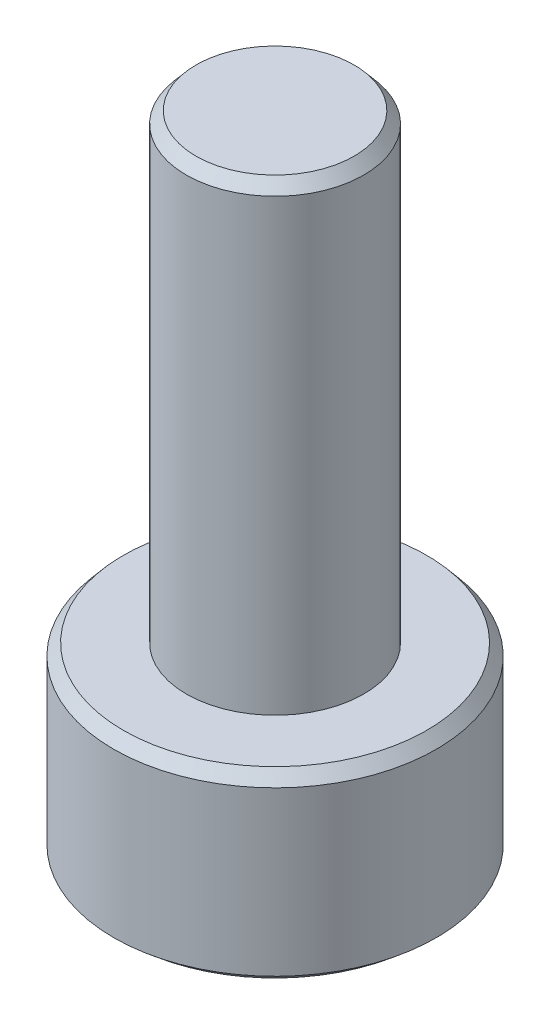
from build123d import *
from OCP.BRepFilletAPI import BRepFilletAPI_MakeChamfer

# Parameters (mm, degrees)
SKETCH1_R           = 3.5
BOSS_EXTRUDE1_DEPTH = 4
SKETCH2_R           = 1.925
BOSS_EXTRUDE2_DEPTH = 10
CUT_EXTRUDE1_DEPTH  = 2
CHAMFER1_SIZE       = 0.25
CHAMFER1_SIZE2      = 0.209774908


with BuildPart() as part:
    # Sketch1 → Boss-Extrude1 (new body)
    with BuildSketch(Plane(origin=(0, 0, 0), x_dir=(1, 0, 0), z_dir=(0, 1, 0))):
        Circle(SKETCH1_R)
    extrude(amount=BOSS_EXTRUDE1_DEPTH)

    # Sketch2 → Boss-Extrude2 (add)
    with BuildSketch(Plane(origin=(0, 4, 0), x_dir=(1, 0, 0), z_dir=(0, 1, 0))):
        Circle(SKETCH2_R)
    extrude(amount=BOSS_EXTRUDE2_DEPTH)

    # Sketch3 → Cut-Extrude1 (cut)
    with BuildSketch(Plane.XZ):
        Polygon((0, 2.37190351), (-2.054128695, 1.185951755), (-2.054128695, -1.185951755), (0, -2.37190351), (2.054128695, -1.185951755), (2.054128695, 1.185951755), align=None)
    extrude(amount=-CUT_EXTRUDE1_DEPTH, mode=Mode.SUBTRACT)

    # Chamfer1: one chamfer whose edges measure the first distance from different faces: ONE call of the kernel's chamfer builder (chamfer() names one face for all edges)
    chamfer1_edges_1 = [part.edges().sort_by_distance(p)[0] for p in [
        (-2.054128695, 0, 0),
        (-1.027064348, 0, -1.778927633),
        (1.027064348, 0, -1.778927633),
        (2.054128695, 0, 0),
        (1.027064348, 0, 1.778927633),
        (-1.027064348, 0, 1.778927633),
        (-3.5, 0, 0),
    ]]
    chamfer1_side_1 = [part.faces().sort_by_distance(p)[0] for p in [
        (-3.401005051, 0, 0),
    ]]
    chamfer1_edges_2 = [part.edges().sort_by_distance(p)[0] for p in [
        (-3.5, 4, 0),
    ]]
    chamfer1_side_2 = [part.faces().sort_by_distance(p)[0] for p in [
        (-3.5, 2, 0),
    ]]
    chamfer1_edges_3 = [part.edges().sort_by_distance(p)[0] for p in [
        (-1.925, 14, 0),
    ]]
    chamfer1_side_3 = [part.faces().sort_by_distance(p)[0] for p in [
        (-1.925, 9, 0),
    ]]
    chamfer1 = BRepFilletAPI_MakeChamfer(part.part.solid().wrapped)
    for e in chamfer1_edges_1:
        chamfer1.Add(CHAMFER1_SIZE, CHAMFER1_SIZE2, e.wrapped, chamfer1_side_1[0].wrapped)  # the first distance lies on this face
    for e in chamfer1_edges_2:
        chamfer1.Add(CHAMFER1_SIZE, CHAMFER1_SIZE2, e.wrapped, chamfer1_side_2[0].wrapped)  # the first distance lies on this face
    for e in chamfer1_edges_3:
        chamfer1.Add(CHAMFER1_SIZE, CHAMFER1_SIZE2, e.wrapped, chamfer1_side_3[0].wrapped)  # the first distance lies on this face
    add(Compound.cast(chamfer1.Shape()), mode=Mode.REPLACE)


solid = part.part
